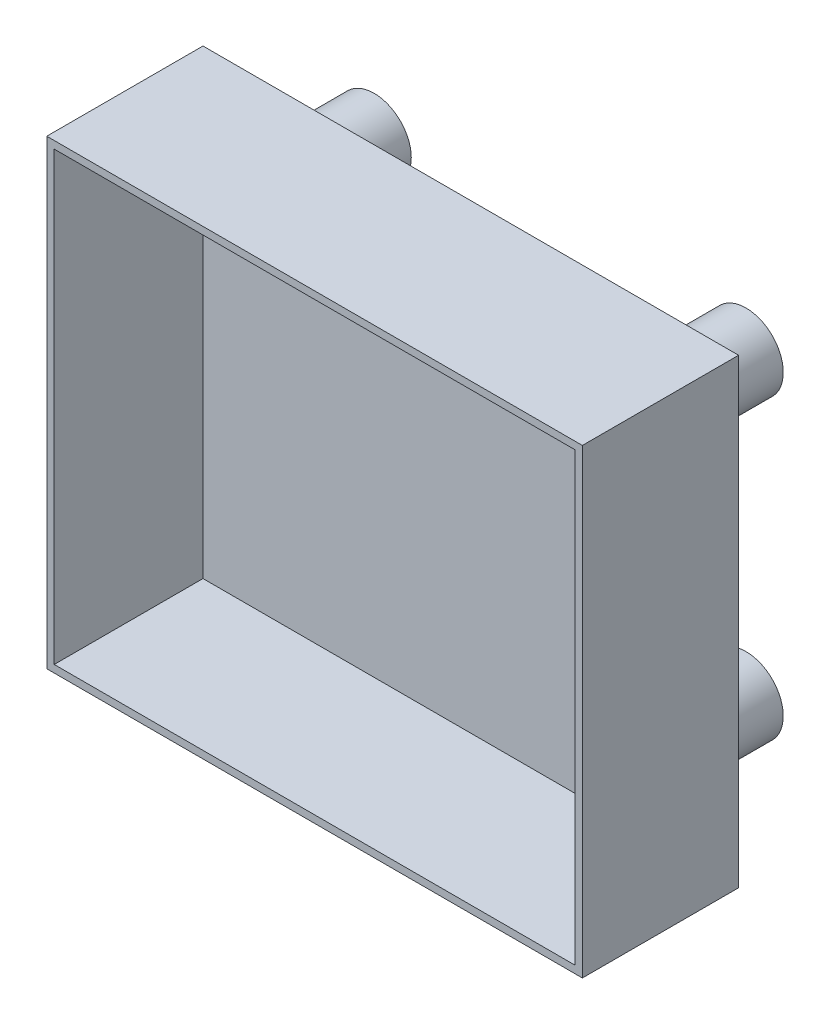
from build123d import *

# Parameters (mm, degrees)
SKETCH2_W               = 177.8
SKETCH2_H               = 152.4
BOSS_EXTRUDE1_DEPTH     = 50.8
SHELL2_T                = 2.54
BOSS_EXTRUDE3_START     = -33.02
BOSS_EXTRUDE3_OUTLINE_R = 12.7
BOSS_EXTRUDE3_DEPTH     = 30.48


# Read off the part's stored shape, not the designer's step: Boss-Extrude3
with BuildPart() as part:
    # Sketch2 → Boss-Extrude1 (new body)
    with BuildSketch(Plane.XY):
        Rectangle(SKETCH2_W, SKETCH2_H)
    extrude(amount=BOSS_EXTRUDE1_DEPTH)

    # Shell2
    shell2_openings = [part.faces().sort_by_distance(p)[0] for p in [
        (0, 0, 50.8),
    ]]
    offset(amount=SHELL2_T, openings=shell2_openings, kind=Kind.INTERSECTION)

    # Boss-Extrude3 outline → Boss-Extrude3 (add)
    with BuildSketch(Plane.XY.offset(BOSS_EXTRUDE3_START)):
        with Locations((-63.5, -50.8)):
            Circle(BOSS_EXTRUDE3_OUTLINE_R)
        with Locations((63.5, -50.8)):
            Circle(BOSS_EXTRUDE3_OUTLINE_R)
        with Locations((63.5, 50.8)):
            Circle(BOSS_EXTRUDE3_OUTLINE_R)
        with Locations((-63.5, 50.8)):
            Circle(BOSS_EXTRUDE3_OUTLINE_R)
    extrude(amount=BOSS_EXTRUDE3_DEPTH)


solid = part.part
